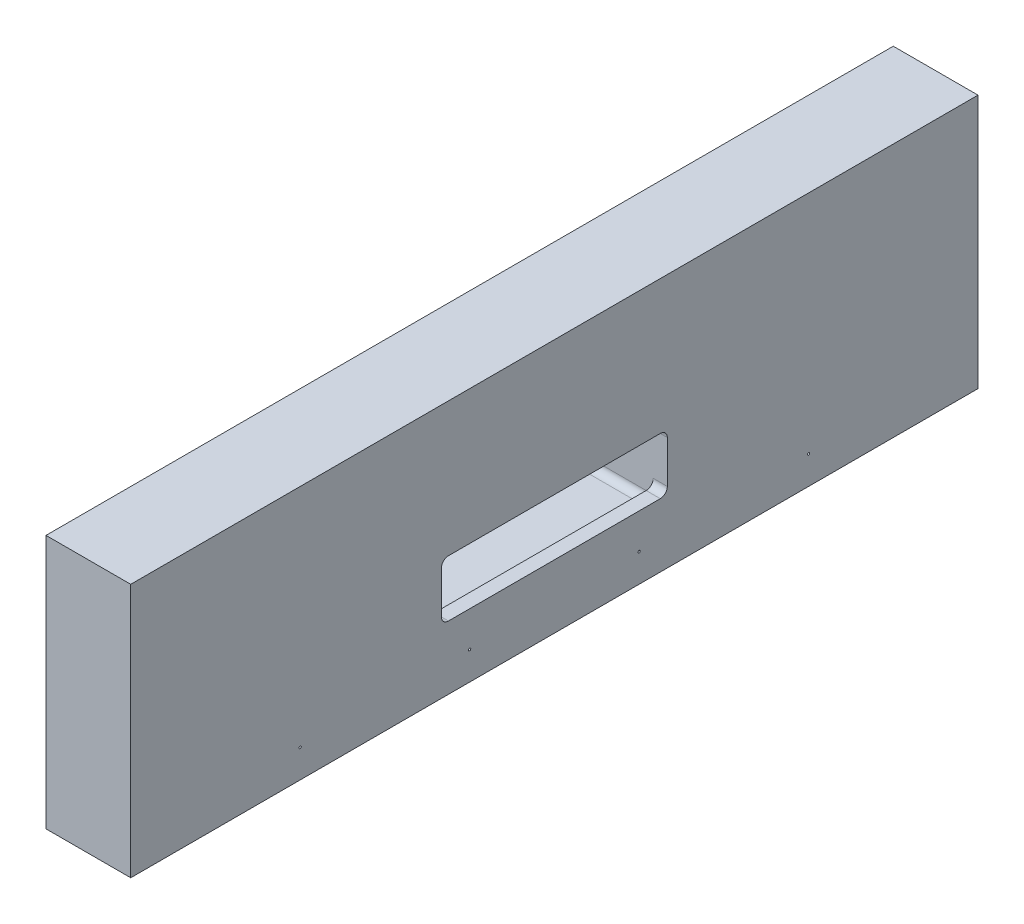
from build123d import *

# Parameters (mm, degrees)
SKETCH1_W           = 762
SKETCH1_H           = 228.6
BOSS_EXTRUDE1_DEPTH = 76.2
SKETCH2_W           = 203.2
SKETCH2_H           = 95.25
CUT_EXTRUDE1_DEPTH  = 63.5
SKETCH3_W           = 203.2
SKETCH3_H           = 50.8
CUT_EXTRUDE2_DEPTH  = 799.081581043
FILLET1_R           = 25.4
SKETCH4_R           = 1.016
CUT_EXTRUDE3_DEPTH  = 800.192342306
LPATTERN1_COUNT     = 4
LPATTERN1_PITCH     = 152.4
FILLET2_R           = 6.35
FILLET3_R           = 6.35


with BuildPart() as part:
    # Sketch1 → Boss-Extrude1 (new body)
    with BuildSketch(Plane(origin=(0, 0, 0), x_dir=(0, 0, -1), z_dir=(1, 0, 0))):
        with Locations((381, 114.3)):
            Rectangle(SKETCH1_W, SKETCH1_H)
    extrude(amount=BOSS_EXTRUDE1_DEPTH)

    # Sketch2 → Cut-Extrude1 (cut)
    with BuildSketch(Plane.ZY):
        with Locations((-381, 92.075)):
            Rectangle(SKETCH2_W, SKETCH2_H)
    extrude(amount=-CUT_EXTRUDE1_DEPTH, mode=Mode.SUBTRACT)

    # Sketch3 → Cut-Extrude2 (cut, through all)
    with BuildSketch(Plane.ZY.offset(-63.5)):
        with Locations((-381, 82.55)):
            Rectangle(SKETCH3_W, SKETCH3_H)
    extrude(amount=-CUT_EXTRUDE2_DEPTH, mode=Mode.SUBTRACT)

    # Fillet1
    fillet1_edges = [part.edges().sort_by_distance(p)[0] for p in [
        (31.75, 139.7, -279.4),
        (31.75, 139.7, -482.6),
    ]]
    fillet(fillet1_edges, radius=FILLET1_R)

    # Sketch4 → Cut-Extrude3 (cut, through all)
    with BuildSketch(Plane.ZY):
        with Locations((-609.6, 25.4)):
            Circle(SKETCH4_R)
    cut_extrude3 = extrude(amount=-CUT_EXTRUDE3_DEPTH, mode=Mode.SUBTRACT)

    # LPattern1: Cut-Extrude3 ×4
    with Locations(*[(0, 0, i * LPATTERN1_PITCH) for i in range(1, LPATTERN1_COUNT)]):
        add(cut_extrude3, mode=Mode.SUBTRACT)

    # Fillet2
    fillet2_edges = [part.edges().sort_by_distance(p)[0] for p in [
        (69.85, 57.15, -482.6),
        (69.85, 107.95, -482.6),
        (69.85, 57.15, -279.4),
        (69.85, 107.95, -279.4),
    ]]
    fillet(fillet2_edges, radius=FILLET2_R)

    # Fillet3
    fillet3_edges = [part.edges().sort_by_distance(p)[0] for p in [
        (31.75, 44.45, -279.4),
        (31.75, 44.45, -482.6),
    ]]
    fillet(fillet3_edges, radius=FILLET3_R)


solid = part.part
